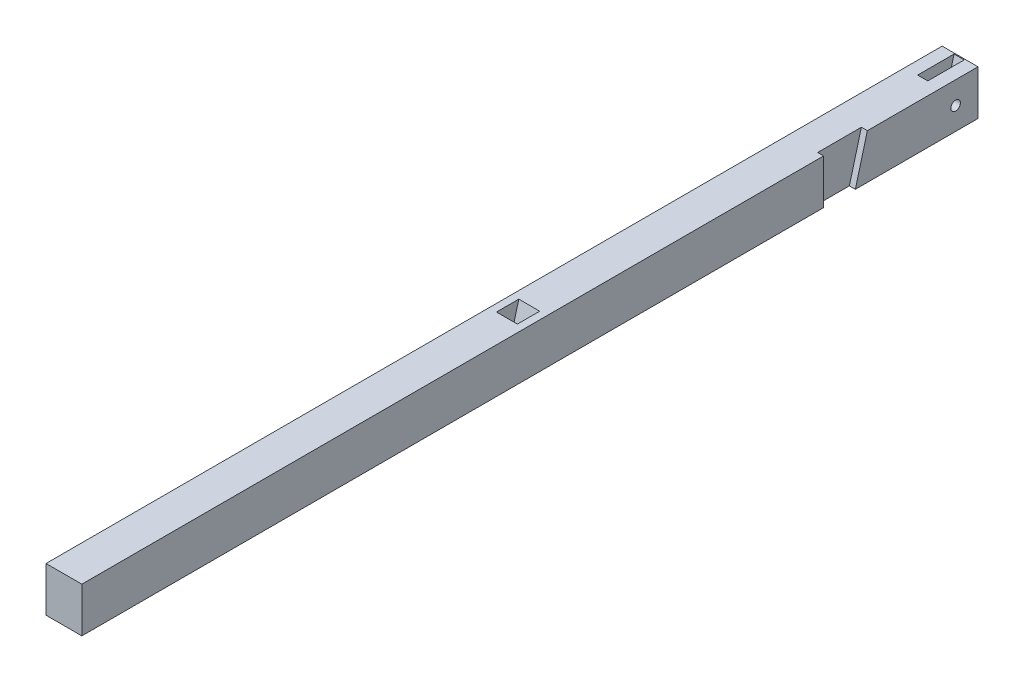
from build123d import *
from build123d.topology import SkipClean

# Parameters (mm, degrees)
BOSS_EXTRUDE1_DEPTH   = 3.5
BOSS_EXTRUDE1_2_DEPTH = 3.5
SKETCH2_W             = 300
SKETCH2_H             = 15
BOSS_EXTRUDE2_DEPTH   = 2.5
SKETCH3_W             = 300
SKETCH3_H             = 15
BOSS_EXTRUDE3_DEPTH   = 0.5
SKETCH4_W             = 248.3
SKETCH4_H             = 15
BOSS_EXTRUDE4_DEPTH   = 2
SKETCH5_W             = 1.6
SKETCH5_H             = 10
M3_CLEARANCE_HOLE2_D  = 3.2
CUT_EXTRUDE2_DEPTH    = 1.7


with BuildPart() as part:
    # Sketch1 → Boss-Extrude1 (new, symmetric)
    with BuildSketch(Plane(origin=(0, 0, 0), x_dir=(0, 0, -1), z_dir=(1, 0, 0))):
        with BuildLine():
            Line((3.5, 0), (150, 0))
            Line((150, 0), (150, 15))
            Line((150, 15), (5.779207393, 15))
            Line((5.779207393, 15), (2.433907922, 2.515172405))
            ThreePointArc((2.433907922, 2.515172405), (3.222474028, 1.365892066), (3.5, 0))
        make_face()
    extrude(amount=BOSS_EXTRUDE1_DEPTH, both=True)



with BuildPart() as body_2:
    # Sketch1 → Boss-Extrude1 2 (new, symmetric)
    with BuildSketch(Plane(origin=(0, 0, 0), x_dir=(0, 0, -1), z_dir=(1, 0, 0))):
        with BuildLine():
            Line((-1.7, 3.059411708), (-1.7, 15))
            Line((-1.7, 15), (-150, 15))
            Line((-150, 15), (-150, 0))
            Line((-150, 0), (-3.5, 0))
            ThreePointArc((-3.5, 0), (-3.016620626, 1.774823935), (-1.7, 3.059411708))
        make_face()
    extrude(amount=BOSS_EXTRUDE1_2_DEPTH, both=True)


with BuildPart() as part_1:
    add(part.part)

    add(body_2.part)  # Boss-Extrude2 merges body 2
    # Sketch2 → Boss-Extrude2 (add)
    with BuildSketch(Plane.ZY.offset(3.5)):
        with Locations((0, 7.5)):
            Rectangle(SKETCH2_W, SKETCH2_H)
    extrude(amount=BOSS_EXTRUDE2_DEPTH)

    # Sketch3 → Boss-Extrude3 (add)
    with BuildSketch(Plane(origin=(3.5, 0, 0), x_dir=(0, 0, -1), z_dir=(1, 0, 0))):
        with Locations((0, 7.5)):
            Rectangle(SKETCH3_W, SKETCH3_H)
    extrude(amount=BOSS_EXTRUDE3_DEPTH)

    # Sketch4 → Boss-Extrude4 (add)
    with BuildSketch(Plane(origin=(4, 0, 0), x_dir=(0, 0, -1), z_dir=(1, 0, 0))):
        with Locations((-25.85, 7.5)):
            Rectangle(SKETCH4_W, SKETCH4_H)
        Polygon((112.958884366, 15), (108.939646479, 0), (150, 0), (150, 15), align=None)
    extrude(amount=BOSS_EXTRUDE4_DEPTH)

    # Sketch5 → M3 Clearance Hole1 (revolve, cut)
    with BuildSketch(Plane(origin=(4, 7.5, -142.5), x_dir=(0, 0, -1), z_dir=(0, 1, 0))):
        with Locations((0.8, 5)):
            Rectangle(SKETCH5_W, SKETCH5_H)
    revolve(axis=Axis((10.35, 7.5, -142.5), (-1, 0, 0)), mode=Mode.SUBTRACT)

    # M3 Clearance Hole2 (through all)
    with Locations(Plane(origin=(4, 7.5, -142.5), x_dir=(0, 0, -1), z_dir=(-1, 0, 0))):
        with Locations((0, 0)):
            Hole(M3_CLEARANCE_HOLE2_D / 2)

    # Sketch7 → Cut-Extrude2 (cut, symmetric)
    with BuildSketch(Plane(origin=(0, 0, 0), x_dir=(0, 0, -1), z_dir=(1, 0, 0))):
        with BuildLine():
            Line((137.5, 7.5), (137.5, 15))
            Line((137.5, 15), (149.685999845, 15))
            Line((149.685999845, 15), (147.329629131, 6.205904774))
            ThreePointArc((147.329629131, 6.205904774), (141.847369039, 2.542775693), (137.5, 7.5))
        make_face()
    extrude(amount=CUT_EXTRUDE2_DEPTH, both=True, mode=Mode.SUBTRACT)


solid = part_1.part
